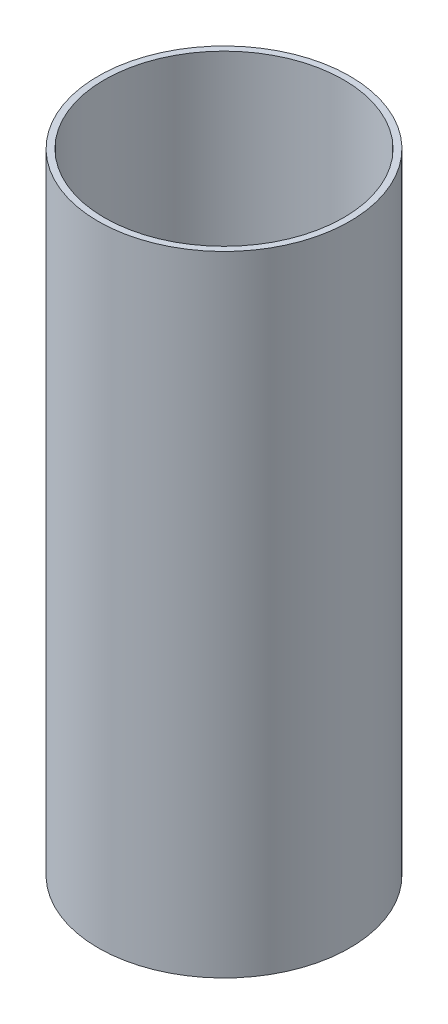
from build123d import *

# Parameters (mm, degrees)
SKETCH1_R           = 40
SKETCH1_R_2         = 38
BOSS_EXTRUDE1_DEPTH = 200


with BuildPart() as part:
    # Sketch1 → Boss-Extrude1 (new body)
    with BuildSketch(Plane(origin=(0, 0, 0), x_dir=(1, 0, 0), z_dir=(0, 1, 0))):
        Circle(SKETCH1_R)
        Circle(SKETCH1_R_2, mode=Mode.SUBTRACT)
    extrude(amount=BOSS_EXTRUDE1_DEPTH)


solid = part.part
